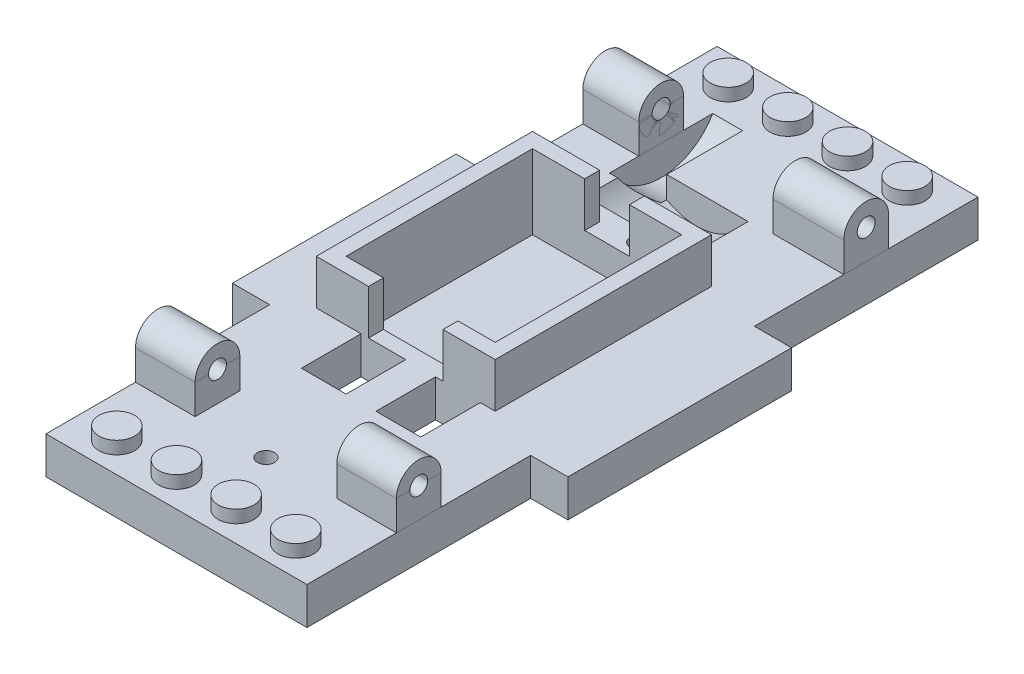
from build123d import *

# Parameters (mm, degrees)
SKETCH1_W             = 9.5
SKETCH1_H             = 1.8
SKETCH1_H_2           = 1.2
SKETCH1_H_3           = 3
SKETCH1_W_2           = 7.5
SKETCH1_W_3           = 8
SKETCH1_H_4           = 6
BOSS_EXTRUDE1_DEPTH   = 4
SKETCH1_3_W           = 8
SKETCH1_3_H           = 1.8
REVOLVE1_ANGLE        = 180
REVOLVE2_START        = -17.5
REVOLVE2_OUTLINE_R    = 3
REVOLVE2_OUTLINE_R_2  = 1.2
REVOLVE2_DEPTH        = 7.5
REVOLVE2_START_2      = 8
REVOLVE2_2_DEPTH      = 9.5
SKETCH1_6_W           = 7.5
SKETCH1_6_H           = 1.2
SKETCH1_6_W_2         = 9.5
BOSS_EXTRUDE2_START   = -4
SKETCH1_7_W           = 35
SKETCH1_7_H           = 90
SKETCH1_7_W_2         = 5
SKETCH1_7_H_2         = 30
BOSS_EXTRUDE2_DEPTH   = 5
SKETCH1_9_W           = 8
SKETCH1_9_H           = 1.2
SKETCH1_10_W          = 4
SKETCH1_10_H          = 3
SKETCH1_10_W_2        = 14
SKETCH1_10_H_2        = 1
CUT_EXTRUDE2_DEPTH    = 4
SKETCH9_R             = 1.15
CUT_EXTRUDE4_DEPTH    = 5
SKETCH10_W            = 6
SKETCH10_H            = 8
CUT_EXTRUDE5_DEPTH    = 5
BOSS_EXTRUDE3_DEPTH   = 6
BOSS_EXTRUDE4_START   = -2.3
SKETCH1_12_R          = 2.4
BOSS_EXTRUDE4_DEPTH   = 1.7
BOSS_EXTRUDE4_2_DEPTH = 1.7
BOSS_EXTRUDE4_3_DEPTH = 1.7
BOSS_EXTRUDE4_4_DEPTH = 1.7
BOSS_EXTRUDE4_5_DEPTH = 1.7
BOSS_EXTRUDE4_6_DEPTH = 1.7
BOSS_EXTRUDE4_7_DEPTH = 1.7
BOSS_EXTRUDE4_8_DEPTH = 1.7
SKETCH11_W            = 8
SKETCH11_H            = 8


# Read off the part's stored shape, not the designer's step: Revolve2
with BuildPart() as part:
    # Sketch1 → Boss-Extrude1 (new body)
    with BuildSketch(Plane(origin=(0, 0, 0), x_dir=(1, 0, 0), z_dir=(0, 1, 0))):
        with Locations((12.75, 27.9)):
            Rectangle(SKETCH1_W, SKETCH1_H)
        with Locations((12.75, 29.4)):
            Rectangle(SKETCH1_W, SKETCH1_H_2)
        with Locations((12.75, 31.5)):
            Rectangle(SKETCH1_W, SKETCH1_H_3)
        with Locations((-13.75, 27.9)):
            Rectangle(SKETCH1_W_2, SKETCH1_H)
        with Locations((-13.75, 29.4)):
            Rectangle(SKETCH1_W_2, SKETCH1_H_2)
        with Locations((-13.75, 31.5)):
            Rectangle(SKETCH1_W_2, SKETCH1_H_3)
        with Locations((13.5, -30)):
            Rectangle(SKETCH1_W_3, SKETCH1_H_4)
        with Locations((-13.5, -30)):
            Rectangle(SKETCH1_W_3, SKETCH1_H_4)
    extrude(amount=-BOSS_EXTRUDE1_DEPTH)

    # Revolve2 2 outline → Revolve2 2 (add)
    with BuildSketch(Plane.YZ.offset(REVOLVE2_START_2)):
        with BuildLine():
            Line((0, -27), (0, -28.8))
            ThreePointArc((0, -28.8), (1.2, -30), (0, -31.2))
            Line((0, -31.2), (0, -33))
            ThreePointArc((0, -33), (3, -30), (0, -27))
        make_face()
    extrude(amount=REVOLVE2_2_DEPTH)

    # Sketch1<6> → Cut-Revolve2 (revolve, cut)
    with BuildSketch(Plane(origin=(0, 0, 0), x_dir=(1, 0, 0), z_dir=(0, 1, 0))):
        with Locations((-13.75, 29.4)):
            Rectangle(SKETCH1_6_W, SKETCH1_6_H)
        with Locations((12.75, 29.4)):
            Rectangle(SKETCH1_6_W_2, SKETCH1_6_H)
        Polygon((-6, 30), (-10, 30), (-10, 28.8), (8, 28.8), (8, 30), align=None)
    revolve(axis=Axis((-17.5, 0, -30), (1, 0, 0)), mode=Mode.SUBTRACT)

    # Sketch1<9> → Cut-Revolve7 (revolve, cut)
    with BuildSketch(Plane(origin=(0, 0, 0), x_dir=(1, 0, 0), z_dir=(0, 1, 0))):
        with Locations((-13.5, -30.6)):
            Rectangle(SKETCH1_9_W, SKETCH1_9_H)
        with Locations((13.5, -30.6)):
            Rectangle(SKETCH1_9_W, SKETCH1_9_H)
    revolve(axis=Axis((-17.5, 0, 30), (1, 0, 0)), mode=Mode.SUBTRACT)


with BuildPart() as body_2:
    # Sketch1<3> → Revolve1 (revolve)
    with BuildSketch(Plane(origin=(0, 0, 0), x_dir=(1, 0, 0), z_dir=(0, 1, 0))):
        with Locations((-13.5, -32.1)):
            Rectangle(SKETCH1_3_W, SKETCH1_3_H)
        with Locations((13.5, -32.1)):
            Rectangle(SKETCH1_3_W, SKETCH1_3_H)
    revolve(axis=Axis((-17.5, 0, 30), (-1, 0, 0)), revolution_arc=REVOLVE1_ANGLE)


with BuildPart() as body_3:
    # Revolve2 outline → Revolve2 (new body)
    with BuildSketch(Plane.YZ.offset(REVOLVE2_START)):
        with Locations((0, -30)):
            Circle(REVOLVE2_OUTLINE_R)
        with Locations((0, -30)):
            Circle(REVOLVE2_OUTLINE_R_2, mode=Mode.SUBTRACT)
    extrude(amount=REVOLVE2_DEPTH)


with BuildPart() as body_4:
    # Sketch1<7> → Boss-Extrude2 (new body)
    with BuildSketch(Plane(origin=(0, 0, 0), x_dir=(1, 0, 0), z_dir=(0, 1, 0)).offset(BOSS_EXTRUDE2_START)):
        Rectangle(SKETCH1_7_W, SKETCH1_7_H)
        with Locations((-20, 0)):
            Rectangle(SKETCH1_7_W_2, SKETCH1_7_H_2)
        with Locations((20, 0)):
            Rectangle(SKETCH1_7_W_2, SKETCH1_7_H_2)
    extrude(amount=-BOSS_EXTRUDE2_DEPTH)

    # Sketch1<10> → Cut-Revolve8 (revolve, cut)
    with BuildSketch(Plane(origin=(0, 0, 0), x_dir=(1, 0, 0), z_dir=(0, 1, 0)), mode=Mode.PRIVATE) as cut_revolve8_sk:
        Polygon((-10, 38), (-10, 33), (-6, 33), (-6, 34), (-6, 38), align=None)
        with Locations((-8, 31.5)):
            Rectangle(SKETCH1_10_W, SKETCH1_10_H)
        with Locations((1, 33.5)):
            Rectangle(SKETCH1_10_W_2, SKETCH1_10_H_2)
        with Locations((1, 31.5)):
            Rectangle(SKETCH1_10_W_2, SKETCH1_10_H)
    revolve(cut_revolve8_sk.sketch.rotate(Axis((-17.5, 0, -30), (1, 0, 0)), 180), axis=Axis((-17.5, 0, -30), (1, 0, 0)), mode=Mode.SUBTRACT)

    # Sketch4 → Cut-Extrude2 (cut)
    with BuildSketch(Plane(origin=(0, -4, 0), x_dir=(1, 0, 0), z_dir=(0, 1, 0))):
        Polygon((-12, 14.75), (-5, 14.75), (8, 14.75), (8, -10.25), (-12, -10.25), align=None)
    extrude(amount=-CUT_EXTRUDE2_DEPTH, mode=Mode.SUBTRACT)

    # Sketch9 → Cut-Extrude4 (cut)
    with BuildSketch(Plane.XZ.offset(9)):
        with Locations(Location((0, 33, 0), (0, 0, 270))):
            Circle(SKETCH9_R)
        with Locations(Location((0, -17, 0), (0, 0, 270))):
            Circle(SKETCH9_R)
    extrude(amount=-CUT_EXTRUDE4_DEPTH, mode=Mode.SUBTRACT)

    # Sketch10 → Cut-Extrude5 (cut)
    with BuildSketch(Plane(origin=(0, -4, 0), x_dir=(1, 0, 0), z_dir=(0, 1, 0))):
        with Locations((-5, -16.25)):
            Rectangle(SKETCH10_W, SKETCH10_H)
        with Locations((5, -16.25)):
            Rectangle(SKETCH10_W, SKETCH10_H)
    extrude(amount=-CUT_EXTRUDE5_DEPTH, mode=Mode.SUBTRACT)

    # Sketch4<6> → Boss-Extrude3 (add)
    with BuildSketch(Plane(origin=(0, -4, 0), x_dir=(1, 0, 0), z_dir=(0, 1, 0))):
        Polygon((-12, -10.25), (-12, 14.75), (-5, 14.75), (-5, 16.75), (-14, 16.75), (-14, -12.25), (-7, -12.25), (-7, -10.25), align=None)
        Polygon((1, 16.75), (1, 14.75), (8, 14.75), (8, -10.25), (3, -10.25), (3, -12.25), (10, -12.25), (10, 16.75), align=None)
    extrude(amount=BOSS_EXTRUDE3_DEPTH)

    # Sketch11 → Cut-Revolve9 (revolve, cut)
    with BuildSketch(Plane(origin=(0, 0, 0), x_dir=(1, 0, 0), z_dir=(0, 1, 0))):
        with Locations((2, 22.75)):
            Rectangle(SKETCH11_W, SKETCH11_H)
    revolve(axis=Axis((-2, 0, -26.75), (0, 0, 1)), mode=Mode.SUBTRACT)


with BuildPart() as body_5:
    # Sketch1<12> → Boss-Extrude4 (new body)
    with BuildSketch(Plane(origin=(0, 0, 0), x_dir=(1, 0, 0), z_dir=(0, 1, 0)).offset(BOSS_EXTRUDE4_START)):
        with Locations(Location((-4, 41, 0), (0, 0, 270))):
            Circle(SKETCH1_12_R)
    extrude(amount=-BOSS_EXTRUDE4_DEPTH)


with BuildPart() as body_6:
    # Sketch1<12> → Boss-Extrude4 2 (new body)
    with BuildSketch(Plane(origin=(0, 0, 0), x_dir=(1, 0, 0), z_dir=(0, 1, 0)).offset(BOSS_EXTRUDE4_START)):
        with Locations(Location((4, 41, 0), (0, 0, 270))):
            Circle(SKETCH1_12_R)
    extrude(amount=-BOSS_EXTRUDE4_2_DEPTH)


with BuildPart() as body_7:
    # Sketch1<12> → Boss-Extrude4 3 (new body)
    with BuildSketch(Plane(origin=(0, 0, 0), x_dir=(1, 0, 0), z_dir=(0, 1, 0)).offset(BOSS_EXTRUDE4_START)):
        with Locations(Location((-12, 41, 0), (0, 0, 270))):
            Circle(SKETCH1_12_R)
    extrude(amount=-BOSS_EXTRUDE4_3_DEPTH)


with BuildPart() as body_8:
    # Sketch1<12> → Boss-Extrude4 4 (new body)
    with BuildSketch(Plane(origin=(0, 0, 0), x_dir=(1, 0, 0), z_dir=(0, 1, 0)).offset(BOSS_EXTRUDE4_START)):
        with Locations(Location((12, 41, 0), (0, 0, 270))):
            Circle(SKETCH1_12_R)
    extrude(amount=-BOSS_EXTRUDE4_4_DEPTH)


with BuildPart() as body_9:
    # Sketch1<12> → Boss-Extrude4 5 (new body)
    with BuildSketch(Plane(origin=(0, 0, 0), x_dir=(1, 0, 0), z_dir=(0, 1, 0)).offset(BOSS_EXTRUDE4_START)):
        with Locations(Location((12, -41, 0), (0, 0, 270))):
            Circle(SKETCH1_12_R)
    extrude(amount=-BOSS_EXTRUDE4_5_DEPTH)


with BuildPart() as body_10:
    # Sketch1<12> → Boss-Extrude4 6 (new body)
    with BuildSketch(Plane(origin=(0, 0, 0), x_dir=(1, 0, 0), z_dir=(0, 1, 0)).offset(BOSS_EXTRUDE4_START)):
        with Locations(Location((4, -41, 0), (0, 0, 270))):
            Circle(SKETCH1_12_R)
    extrude(amount=-BOSS_EXTRUDE4_6_DEPTH)


with BuildPart() as body_11:
    # Sketch1<12> → Boss-Extrude4 7 (new body)
    with BuildSketch(Plane(origin=(0, 0, 0), x_dir=(1, 0, 0), z_dir=(0, 1, 0)).offset(BOSS_EXTRUDE4_START)):
        with Locations(Location((-4, -41, 0), (0, 0, 270))):
            Circle(SKETCH1_12_R)
    extrude(amount=-BOSS_EXTRUDE4_7_DEPTH)


with BuildPart() as body_12:
    # Sketch1<12> → Boss-Extrude4 8 (new body)
    with BuildSketch(Plane(origin=(0, 0, 0), x_dir=(1, 0, 0), z_dir=(0, 1, 0)).offset(BOSS_EXTRUDE4_START)):
        with Locations(Location((-12, -41, 0), (0, 0, 270))):
            Circle(SKETCH1_12_R)
    extrude(amount=-BOSS_EXTRUDE4_8_DEPTH)


solid = Compound([part.part, body_2.part, body_3.part, body_4.part, body_5.part, body_6.part, body_7.part, body_8.part, body_9.part, body_10.part, body_11.part, body_12.part])
